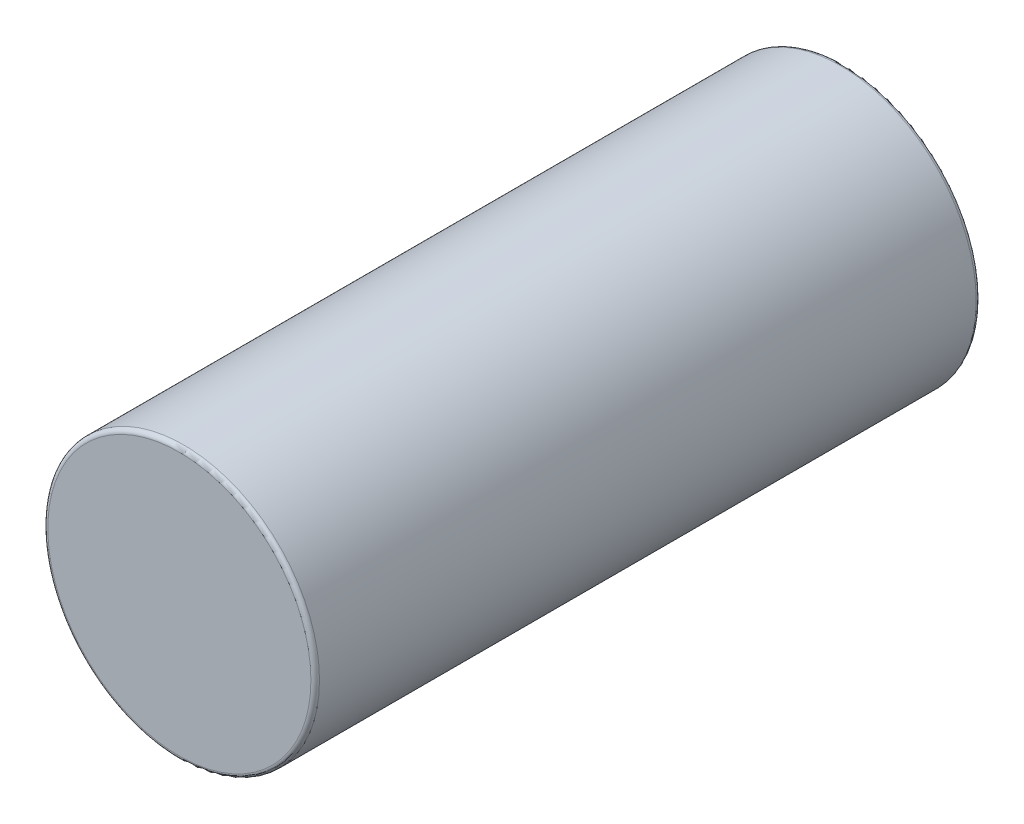
from build123d import *

# Parameters (mm, degrees)
CYCL_DEPTH      = 15.5
CYCL_DEPTH_BACK = 15.5
DIA_R           = 6.33
FILLET1_R       = 0.2


with BuildPart() as part:
    # dia → cycl (new, two sides: drawn at the far end of the back side and taken through both)
    with BuildSketch(Plane.XY.offset(-CYCL_DEPTH_BACK)):
        Circle(DIA_R)
    extrude(amount=CYCL_DEPTH + CYCL_DEPTH_BACK)

    # Fillet1
    fillet1_edges = [part.edges().sort_by_distance(p)[0] for p in [
        (-6.33, 0, 15.5),
        (-6.33, 0, -15.5),
    ]]
    fillet(fillet1_edges, radius=FILLET1_R)


solid = part.part
